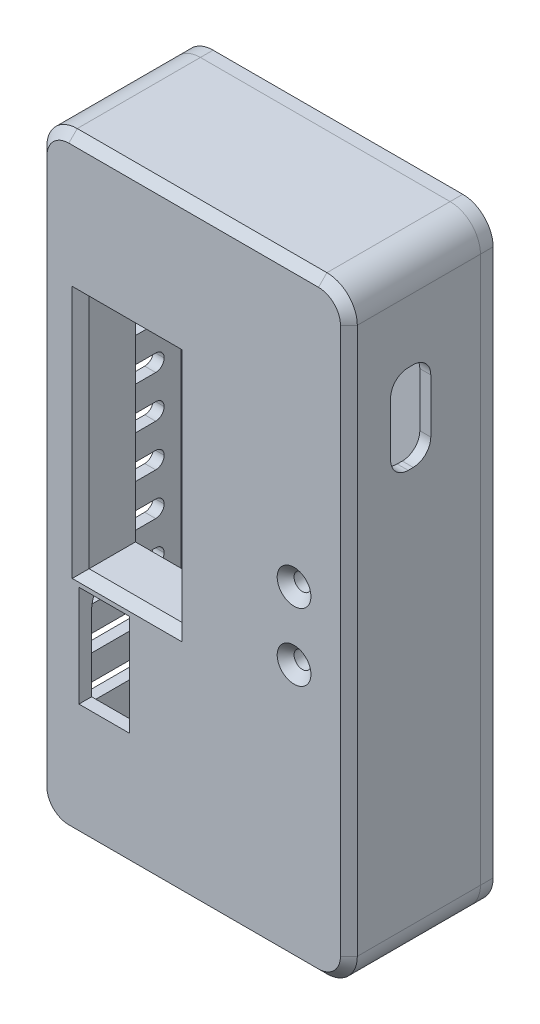
from build123d import *

# Parameters (mm, degrees)
BOSS_EXTRUDE1_DEPTH = 14.100480315
BOSS_EXTRUDE2_DEPTH = 1.5
SKETCH3_R           = 1
SKETCH3_W           = 6
SKETCH3_H           = 12
SKETCH3_W_2         = 11
SKETCH3_H_2         = 28
CUT_EXTRUDE1_DEPTH  = 3.5
SKETCH4_R           = 3.8
CUT_EXTRUDE2_DEPTH  = 3.5
CUT_EXTRUDE3_DEPTH  = 3.5
FILLET1_R           = 2.3
FILLET2_R           = 3.6
SKETCH6_W           = 13
SKETCH6_H           = 30
SKETCH6_W_2         = 11
SKETCH6_H_2         = 28
BOSS_EXTRUDE3_DEPTH = 5
FILLET3_START       = 1230.965822468
FILLET3_DEPTH       = 13
FILLET3_START_2     = 1237.765822468
FILLET3_2_DEPTH     = 6.2
FILLET3_3_DEPTH     = 0.8
FILLET3_START_3     = -31.017397721
FILLET3_4_DEPTH     = 36.104289338
FILLET3_START_4     = -31.565253052
FILLET3_5_DEPTH     = 37.2
FILLET3_START_5     = 1228.265822468
FILLET3_6_DEPTH     = 20.734177532
FILLET3_START_6     = 1227
FILLET3_7_DEPTH     = 3.965822468
CHAMFER1_SIZE       = 1
SKETCH7_R           = 2
SKETCH7_R_2         = 1
BOSS_EXTRUDE4_DEPTH = 5
CHAMFER2_SIZE       = 1
CHAMFER3_SIZE       = 1
CHAMFER4_SIZE       = 1.5
SKETCH8_W           = 10.600480315
SKETCH8_H           = 2
CUT_EXTRUDE4_DEPTH  = 2
FILLET4_R           = 1
BOSS_EXTRUDE5_DEPTH = 1.5
SKETCH10_W          = 20
SKETCH10_H          = 3
BOSS_EXTRUDE6_DEPTH = 2
SKETCH11_R          = 1.25
CUT_EXTRUDE5_DEPTH  = 2


with BuildPart() as part:
    # Sketch1 → Boss-Extrude1 (new body)
    with BuildSketch(Plane.XY):
        with BuildLine():
            Line((1226.965822468, 17.534745948), (1226.965822468, 3.534745948))
            Line((1226.965822468, 3.534745948), (1226.965822468, -54.465253052))
            Line((1226.965822468, -54.465253052), (1260.169362435, -54.465253052))
            ThreePointArc((1260.169362435, -54.465253052), (1262.714946848, -53.410837464), (1263.769362435, -50.865253052))
            Line((1263.769362435, -50.865253052), (1263.769362435, 13.934745948))
            ThreePointArc((1263.769362435, 13.934745948), (1262.714946848, 16.48033036), (1260.169362435, 17.534745948))
            Line((1260.169362435, 17.534745948), (1226.965822468, 17.534745948))
        make_face()
        with BuildLine():
            Line((1228.265822468, -53.165253052), (1260.169362435, -53.165253052))
            ThreePointArc((1260.169362435, -53.165253052), (1261.795708032, -52.491598649), (1262.469362435, -50.865253052))
            Line((1262.469362435, -50.865253052), (1262.469362435, 13.934745948))
            ThreePointArc((1262.469362435, 13.934745948), (1261.795708032, 15.561091545), (1260.169362435, 16.234745948))
            Line((1260.169362435, 16.234745948), (1228.265822468, 16.234745948))
            Line((1228.265822468, 16.234745948), (1228.265822468, 3.534745948))
            Line((1228.265822468, 3.534745948), (1228.265822468, -53.165253052))
        make_face(mode=Mode.SUBTRACT)
    extrude(amount=BOSS_EXTRUDE1_DEPTH)

    # Sketch2 → Boss-Extrude2 (add)
    with BuildSketch(Plane.XY.offset(14.100480315)):
        with BuildLine():
            Line((1226.965822468, 17.534745948), (1226.965822468, -54.465253052))
            Line((1226.965822468, -54.465253052), (1260.169362435, -54.465253052))
            ThreePointArc((1260.169362435, -54.465253052), (1262.714946848, -53.410837464), (1263.769362435, -50.865253052))
            Line((1263.769362435, -50.865253052), (1263.769362435, 13.934745948))
            ThreePointArc((1263.769362435, 13.934745948), (1262.714946848, 16.48033036), (1260.169362435, 17.534745948))
            Line((1260.169362435, 17.534745948), (1226.965822468, 17.534745948))
        make_face()
    extrude(amount=BOSS_EXTRUDE2_DEPTH)

    # Sketch3 → Cut-Extrude1 (cut)
    with BuildSketch(Plane.XY.offset(15.600480315)):
        with Locations((1257.269362435, -23.665253052)):
            Circle(SKETCH3_R)
        with Locations((1257.269362435, -15.665253052)):
            Circle(SKETCH3_R)
        with Locations((1234.765822468, -34.465253052)):
            Rectangle(SKETCH3_W, SKETCH3_H)
        with Locations((1237.465822468, -12.965253052)):
            Rectangle(SKETCH3_W_2, SKETCH3_H_2)
    extrude(amount=-CUT_EXTRUDE1_DEPTH, mode=Mode.SUBTRACT)

    # Sketch4 → Cut-Extrude2 (cut)
    with BuildSketch(Plane.XZ.offset(54.465253052)):
        with Locations((1247.290557046, 10.250480155)):
            Circle(SKETCH4_R)
    extrude(amount=-CUT_EXTRUDE2_DEPTH, mode=Mode.SUBTRACT)

    # Sketch5 → Cut-Extrude3 (cut)
    with BuildSketch(Plane(origin=(1263.769362435, 0, 0), x_dir=(0, 0, -1), z_dir=(1, 0, 0))):
        with BuildLine():
            Line((-10.65000149, 4.484498296), (-10.65000149, -1.895501704))
            ThreePointArc((-10.65000149, -1.895501704), (-10.040783595, -3.366283809), (-8.57000149, -3.975501704))
            Line((-8.57000149, -3.975501704), (-7.97000149, -3.975501704))
            ThreePointArc((-7.97000149, -3.975501704), (-6.499219385, -3.366283809), (-5.89000149, -1.895501704))
            Line((-5.89000149, -1.895501704), (-5.89000149, 0.794498296))
            Line((-5.89000149, 0.794498296), (-5.89000149, 4.484498296))
            ThreePointArc((-5.89000149, 4.484498296), (-6.499219385, 5.955280401), (-7.97000149, 6.564498296))
            Line((-7.97000149, 6.564498296), (-8.57000149, 6.564498296))
            ThreePointArc((-8.57000149, 6.564498296), (-10.040783595, 5.955280401), (-10.65000149, 4.484498296))
        make_face()
    extrude(amount=-CUT_EXTRUDE3_DEPTH, mode=Mode.SUBTRACT)

    # Fillet1
    fillet1_edges = [part.edges().sort_by_distance(p)[0] for p in [
        (1228.265822468, 16.234745948, 7.050240158),
        (1228.265822468, -53.165253052, 7.050240158),
    ]]
    fillet(fillet1_edges, radius=FILLET1_R)

    # Fillet2
    fillet2_edges = [part.edges().sort_by_distance(p)[0] for p in [
        (1226.965822468, 17.534745948, 7.800240157),
        (1226.965822468, -54.465253052, 7.800240157),
    ]]
    fillet(fillet2_edges, radius=FILLET2_R)

    # Sketch6 → Boss-Extrude3 (add)
    with BuildSketch(Plane(origin=(0, 0, 14.100480315), x_dir=(-1, 0, 0), z_dir=(0, 0, -1))):
        with Locations((-1237.465822468, -12.965253052)):
            Rectangle(SKETCH6_W, SKETCH6_H)
        with Locations((-1237.465822468, -12.965253052)):
            Rectangle(SKETCH6_W_2, SKETCH6_H_2, mode=Mode.SUBTRACT)
    extrude(amount=BOSS_EXTRUDE3_DEPTH)

    # Fillet3: read off the stored shape, not the designer's step
    # Fillet3 outline → Fillet3 (add)
    with BuildSketch(Plane.YZ.offset(FILLET3_START)):
        with BuildLine():
            Line((-28.465253052, 14.100480315), (-28.465253052, 12.330780836))
            ThreePointArc((-28.465253052, 12.330780836), (-28.092501981, 11.449163613), (-27.965253052, 10.500480315))
            Line((-27.965253052, 10.500480315), (-27.965253052, 14.100480315))
            Line((-27.965253052, 14.100480315), (-28.465253052, 14.100480315))
        make_face()
        with BuildLine():
            Line((5.634746948, 14.100480315), (2.034746948, 14.100480315))
            Line((2.034746948, 14.100480315), (2.034746948, 10.500480315))
            ThreePointArc((2.034746948, 10.500480315), (3.089162536, 13.046064727), (5.634746948, 14.100480315))
        make_face()
    extrude(amount=FILLET3_DEPTH)

    # Fillet3 2 outline → Fillet3 2 (add)
    with BuildSketch(Plane.YZ.offset(FILLET3_START_2)):
        with BuildLine():
            ThreePointArc((-31.565253052, 14.100480315), (-29.780467614, 13.626906539), (-28.465253052, 12.330780836))
            Line((-28.465253052, 12.330780836), (-28.465253052, 14.100480315))
            Line((-28.465253052, 14.100480315), (-31.565253052, 14.100480315))
        make_face()
    extrude(amount=FILLET3_2_DEPTH)

    # Fillet3 3 outline → Fillet3 3 (add)
    with BuildSketch(Plane.YZ.offset(FILLET3_START)):
        with BuildLine():
            ThreePointArc((-31.565253052, 14.100480315), (-29.780467614, 13.626906539), (-28.465253052, 12.330780836))
            Line((-28.465253052, 12.330780836), (-28.465253052, 14.100480315))
            Line((-28.465253052, 14.100480315), (-31.565253052, 14.100480315))
        make_face()
    extrude(amount=FILLET3_3_DEPTH)

    # Fillet3 4 outline → Fillet3 4 (add)
    with BuildSketch(Plane(origin=(0, 0, 0), x_dir=(1, 0, 0), z_dir=(0, 1, 0)).offset(FILLET3_START_3)):
        with BuildLine():
            Line((1228.265822468, -14.100480315), (1230.965822468, -14.100480315))
            Line((1230.965822468, -14.100480315), (1230.965822468, -10.500480315))
            ThreePointArc((1230.965822468, -10.500480315), (1230.211872362, -12.705021083), (1228.265822468, -13.986165326))
            Line((1228.265822468, -13.986165326), (1228.265822468, -14.100480315))
        make_face()
        with BuildLine():
            ThreePointArc((1247.565822468, -14.100480315), (1245.020238056, -13.046064727), (1243.965822468, -10.500480315))
            Line((1243.965822468, -10.500480315), (1243.965822468, -14.100480315))
            Line((1243.965822468, -14.100480315), (1247.565822468, -14.100480315))
        make_face()
    extrude(amount=FILLET3_4_DEPTH)

    # Fillet3 5 outline → Fillet3 5 (add)
    with BuildSketch(Plane(origin=(0, 0, 0), x_dir=(1, 0, 0), z_dir=(0, 1, 0)).offset(FILLET3_START_4)):
        with BuildLine():
            ThreePointArc((1247.565822468, -14.100480315), (1245.020238056, -13.046064727), (1243.965822468, -10.500480315))
            Line((1243.965822468, -10.500480315), (1243.965822468, -14.100480315))
            Line((1243.965822468, -14.100480315), (1247.565822468, -14.100480315))
        make_face()
    extrude(amount=FILLET3_5_DEPTH)

    # Fillet3 6 outline → Fillet3 6 (cut)
    with BuildSketch(Plane.YZ.offset(FILLET3_START_5)):
        with BuildLine():
            Line((-31.565253052, 10.500480315), (-27.965253052, 10.500480315))
            ThreePointArc((-27.965253052, 10.500480315), (-28.092501981, 11.449163613), (-28.465253052, 12.330780836))
            ThreePointArc((-28.465253052, 12.330780836), (-29.780467614, 13.626906539), (-31.565253052, 14.100480315))
            Line((-31.565253052, 14.100480315), (-31.565253052, 10.500480315))
        make_face()
        with BuildLine():
            Line((5.634746948, 10.500480315), (5.634746948, 14.100480315))
            ThreePointArc((5.634746948, 14.100480315), (3.089162536, 13.046064727), (2.034746948, 10.500480315))
            Line((2.034746948, 10.500480315), (5.634746948, 10.500480315))
        make_face()
    extrude(amount=FILLET3_6_DEPTH, mode=Mode.SUBTRACT)

    # Fillet3 7 outline → Fillet3 7 (add)
    with BuildSketch(Plane.YZ.offset(FILLET3_START_6)):
        with BuildLine():
            Line((-31.017397721, 14.058549248), (-31.017397721, 14.100480315))
            Line((-31.017397721, 14.100480315), (-31.565253052, 14.100480315))
            ThreePointArc((-31.565253052, 14.100480315), (-31.290524241, 14.089982241), (-31.017397721, 14.058549248))
        make_face()
        with BuildLine():
            ThreePointArc((5.086891617, 14.058549248), (5.360018137, 14.089982241), (5.634746948, 14.100480315))
            Line((5.634746948, 14.100480315), (5.086891617, 14.100480315))
            Line((5.086891617, 14.100480315), (5.086891617, 14.058549248))
        make_face()
    extrude(amount=FILLET3_7_DEPTH)

    # Chamfer1
    chamfer1_edges = [part.edges().sort_by_distance(p)[0] for p in [
        (1231.965822468, -12.965253052, 15.600480315),
        (1237.465822468, -26.965253052, 15.600480315),
        (1242.965822468, -12.965253052, 15.600480315),
        (1237.465822468, 1.034746948, 15.600480315),
    ]]
    chamfer(chamfer1_edges, length=CHAMFER1_SIZE)

    # Sketch7 → Boss-Extrude4 (add)
    # profile 1 of 2: a face of its own
    with BuildSketch(Plane(origin=(0, 0, 14.100480315), x_dir=(-1, 0, 0), z_dir=(0, 0, -1))):
        with Locations(Location((-1257.269362435, -15.665253052, 0), (0, 0, 180))):
            Circle(SKETCH7_R)
        with Locations(Location((-1257.269362435, -15.665253052, 0), (0, 0, 180))):
            Circle(SKETCH7_R_2, mode=Mode.SUBTRACT)
    # profile 2 of 2: a face of its own
    with BuildSketch(Plane(origin=(0, 0, 14.100480315), x_dir=(-1, 0, 0), z_dir=(0, 0, -1))):
        with Locations(Location((-1257.269362435, -23.665253052, 0), (0, 0, 180))):
            Circle(SKETCH7_R)
        with Locations(Location((-1257.269362435, -23.665253052, 0), (0, 0, 180))):
            Circle(SKETCH7_R_2, mode=Mode.SUBTRACT)
    extrude(amount=BOSS_EXTRUDE4_DEPTH)

    # Chamfer2
    chamfer2_edges = [part.edges().sort_by_distance(p)[0] for p in [
        (1256.269362435, -15.665253052, 15.600480315),
        (1256.269362435, -23.665253052, 15.600480315),
    ]]
    chamfer(chamfer2_edges, length=CHAMFER2_SIZE)

    # Chamfer3
    chamfer3_edges = [part.edges().sort_by_distance(p)[0] for p in [
        (1245.367592452, -54.465253052, 15.600480315),
        (1226.965822468, -18.465253552, 15.600480315),
        (1228.020238056, 16.48033036, 15.600480315),
        (1228.020238056, -53.410837464, 15.600480315),
        (1245.367592452, 17.534745948, 15.600480315),
        (1262.714946848, -53.410837464, 15.600480315),
        (1263.769362435, -18.465253552, 15.600480315),
        (1262.714946848, 16.48033036, 15.600480315),
    ]]
    chamfer(chamfer3_edges, length=CHAMFER3_SIZE)

    # Chamfer4
    chamfer4_edges = [part.edges().sort_by_distance(p)[0] for p in [
        (1255.269362435, -15.665253052, 14.100480315),
        (1255.269362435, -23.665253052, 14.100480315),
    ]]
    chamfer(chamfer4_edges, length=CHAMFER4_SIZE)

    # Sketch8 → Cut-Extrude4 (cut)
    with BuildSketch(Plane.ZY.offset(-1226.965822468)):
        with Locations((7.300240158, -13.465253552)):
            Rectangle(SKETCH8_W, SKETCH8_H)
        with Locations((7.300240158, -18.465253552)):
            Rectangle(SKETCH8_W, SKETCH8_H)
        with Locations((7.300240158, -8.465253552)):
            Rectangle(SKETCH8_W, SKETCH8_H)
        with Locations((7.300240158, -3.465253552)):
            Rectangle(SKETCH8_W, SKETCH8_H)
        with Locations((7.300240158, 1.534746448)):
            Rectangle(SKETCH8_W, SKETCH8_H)
        with Locations((7.300240158, 6.534746448)):
            Rectangle(SKETCH8_W, SKETCH8_H)
        with Locations((7.300240158, -23.465253552)):
            Rectangle(SKETCH8_W, SKETCH8_H)
        with Locations((7.300240158, -28.465253552)):
            Rectangle(SKETCH8_W, SKETCH8_H)
        with Locations((7.300240158, -33.465253552)):
            Rectangle(SKETCH8_W, SKETCH8_H)
        with Locations((7.300240158, -38.465253552)):
            Rectangle(SKETCH8_W, SKETCH8_H)
        with Locations((7.300240158, -43.465253552)):
            Rectangle(SKETCH8_W, SKETCH8_H)
    extrude(amount=-CUT_EXTRUDE4_DEPTH, mode=Mode.SUBTRACT)

    # Fillet4
    fillet4_edges = [part.edges().sort_by_distance(p)[0] for p in [
        (1227.615822468, 0.534746448, 2),
        (1227.615822468, -4.465253552, 2),
        (1227.615822468, -9.465253552, 2),
        (1227.615822468, -14.465253552, 2),
        (1227.615822468, -19.465253552, 2),
        (1227.615822468, -24.465253552, 2),
        (1227.615822468, -29.465253552, 2),
        (1227.615822468, -34.465253552, 2),
        (1227.615822468, -39.465253552, 2),
        (1227.615822468, -44.465253552, 2),
        (1227.615822468, -42.465253552, 2),
        (1227.615822468, -37.465253552, 2),
        (1227.615822468, -32.465253552, 2),
        (1227.615822468, -27.465253552, 2),
        (1227.615822468, -22.465253552, 2),
        (1227.615822468, -17.465253552, 2),
        (1227.615822468, -12.465253552, 2),
        (1227.615822468, -7.465253552, 2),
        (1227.615822468, -2.465253552, 2),
        (1227.615822468, 2.534746448, 2),
        (1227.615822468, 2.534746448, 12.600480315),
        (1227.615822468, -2.465253552, 12.600480315),
        (1227.615822468, -7.465253552, 12.600480315),
        (1227.615822468, -12.465253552, 12.600480315),
        (1227.615822468, -17.465253552, 12.600480315),
        (1227.615822468, -22.465253552, 12.600480315),
        (1227.615822468, -27.465253552, 12.600480315),
        (1227.615822468, -32.465253552, 12.600480315),
        (1227.615822468, -37.465253552, 12.600480315),
        (1227.615822468, -42.465253552, 12.600480315),
        (1227.615822468, -44.465253552, 12.600480315),
        (1227.615822468, -39.465253552, 12.600480315),
        (1227.615822468, -34.465253552, 12.600480315),
        (1227.615822468, -29.465253552, 12.600480315),
        (1227.615822468, -24.465253552, 12.600480315),
        (1227.615822468, -19.465253552, 12.600480315),
        (1227.615822468, -14.465253552, 12.600480315),
        (1227.615822468, -9.465253552, 12.600480315),
        (1227.615822468, -4.465253552, 12.600480315),
        (1227.615822468, 0.534746448, 12.600480315),
        (1227.615822468, 5.534746448, 12.600480315),
        (1227.615822468, 7.534746448, 12.600480315),
        (1227.615822468, 5.534746448, 2),
        (1227.615822468, 7.534746448, 2),
    ]]
    fillet(fillet4_edges, radius=FILLET4_R - 0.0001)  # a hair under: the kernel refuses the full size


with BuildPart() as body_2:
    # Sketch9 → Boss-Extrude5 (new body)
    with BuildSketch(Plane(origin=(0, 0, 0), x_dir=(-1, 0, 0), z_dir=(0, 0, -1))):
        with BuildLine():
            Line((-1260.169362435, -54.465253052), (-1230.565822468, -54.465253052))
            ThreePointArc((-1230.565822468, -54.465253052), (-1228.020238056, -53.410837464), (-1226.965822468, -50.865253052))
            Line((-1226.965822468, -50.865253052), (-1226.965822468, 13.934745948))
            ThreePointArc((-1226.965822468, 13.934745948), (-1228.020238056, 16.48033036), (-1230.565822468, 17.534745948))
            Line((-1230.565822468, 17.534745948), (-1260.169362435, 17.534745948))
            ThreePointArc((-1260.169362435, 17.534745948), (-1262.714946848, 16.48033036), (-1263.769362435, 13.934745948))
            Line((-1263.769362435, 13.934745948), (-1263.769362435, -50.865253052))
            ThreePointArc((-1263.769362435, -50.865253052), (-1262.714946848, -53.410837464), (-1260.169362435, -54.465253052))
        make_face()
    extrude(amount=BOSS_EXTRUDE5_DEPTH)

    # Sketch10 → Boss-Extrude6 (add)
    with BuildSketch(Plane.XY):
        with Locations((1245.367592452, 14.634745948)):
            Rectangle(SKETCH10_W, SKETCH10_H)
        with Locations((1245.367592452, -51.565253052)):
            Rectangle(SKETCH10_W, SKETCH10_H)
    extrude(amount=BOSS_EXTRUDE6_DEPTH)

    # Sketch11 → Cut-Extrude5 (cut)
    with BuildSketch(Plane(origin=(0, 0, -1.5), x_dir=(-1, 0, 0), z_dir=(0, 0, -1))):
        with Locations((-1257.769362435, -47.465253052)):
            Circle(SKETCH11_R)
        with Locations((-1234.769362435, -47.465253052)):
            Circle(SKETCH11_R)
        with Locations((-1257.769362435, 10.534745948)):
            Circle(SKETCH11_R)
        with Locations((-1234.769362435, 10.534745948)):
            Circle(SKETCH11_R)
    extrude(amount=-CUT_EXTRUDE5_DEPTH, mode=Mode.SUBTRACT)


solid = Compound([part.part, body_2.part])
